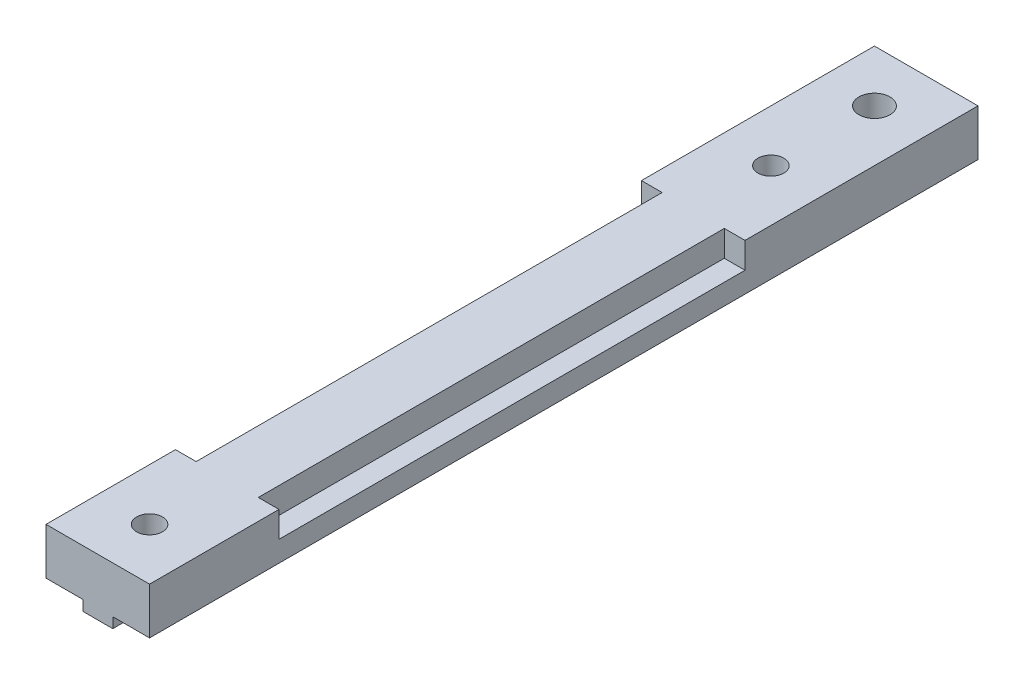
from build123d import *

# Parameters (mm, degrees)
MAIN_DEPTH         = 80
SKETCH2_R          = 1.25
SKETCH2_R_2        = 1.5
CUT_EXTRUDE1_DEPTH = 81.344570445
SKETCH3_W          = 2
SKETCH3_H          = 45
CUT_EXTRUDE2_DEPTH = 2.5


with BuildPart() as part:
    # Sketch1 → Main (new body)
    with BuildSketch(Plane.XY):
        Polygon((-5, 0), (5, 0), (5, -4.5), (1.45, -4.5), (1.45, -5.5), (-1.45, -5.5), (-1.45, -4.5), (-5, -4.5), align=None)
    extrude(amount=MAIN_DEPTH)

    # Sketch2 → Cut-Extrude1 (cut, through all)
    with BuildSketch(Plane(origin=(0, 0, 0), x_dir=(1, 0, 0), z_dir=(0, 1, 0))):
        with Locations((0, -75)):
            Circle(SKETCH2_R)
        with Locations((0, -15)):
            Circle(SKETCH2_R)
        with Locations((0, -5)):
            Circle(SKETCH2_R_2)
    extrude(amount=-CUT_EXTRUDE1_DEPTH, mode=Mode.SUBTRACT)

    # Sketch3 → Cut-Extrude2 (cut)
    with BuildSketch(Plane(origin=(0, 0, 0), x_dir=(1, 0, 0), z_dir=(0, 1, 0))):
        with Locations((-4, -45)):
            Rectangle(SKETCH3_W, SKETCH3_H)
        with Locations((4, -45)):
            Rectangle(SKETCH3_W, SKETCH3_H)
    extrude(amount=-CUT_EXTRUDE2_DEPTH, mode=Mode.SUBTRACT)


solid = part.part
